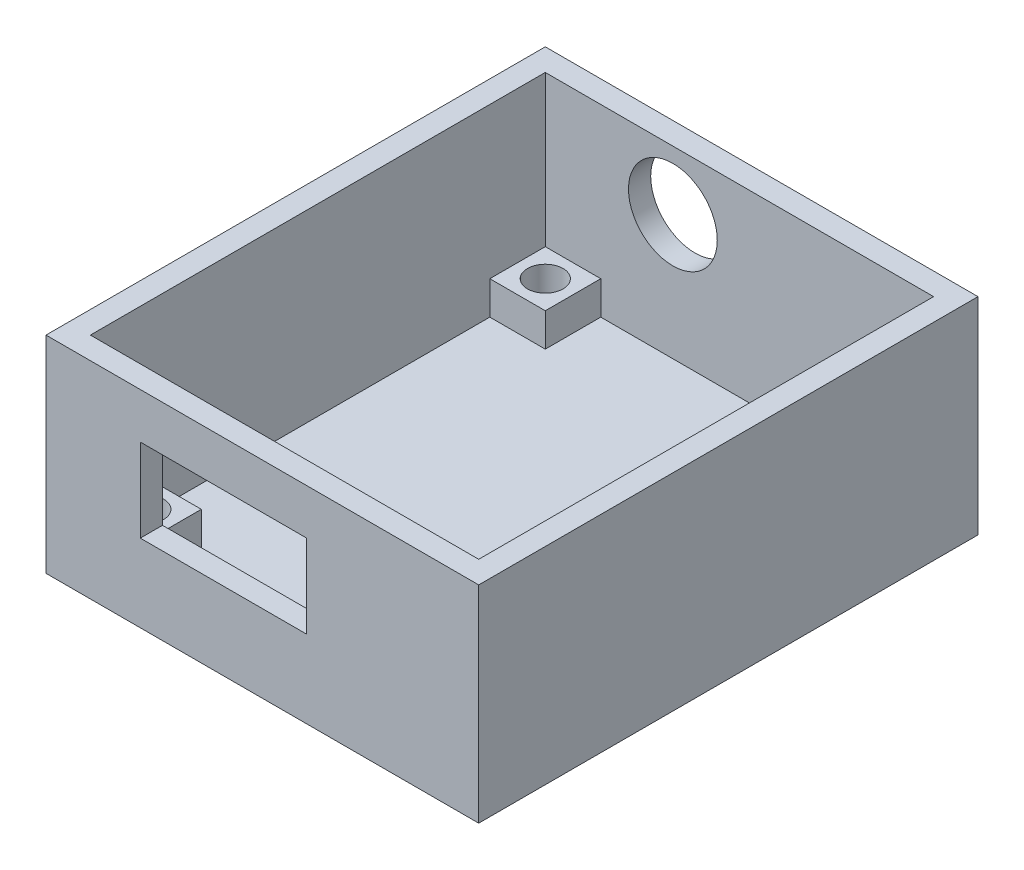
from build123d import *

# Parameters (mm, degrees)
SKETCH1_W             = 39
SKETCH1_H             = 45
BODY_DEPTH            = 18.6
SHELL1_T              = -2
SKETCH3_W             = 5
SKETCH3_H             = 5
INSERTS_SUPPORT_DEPTH = 3
SKETCH4_R             = 1.6
INSERTS_HOLES_DEPTH   = 4
USB_HOLE_REACH        = 54.452
SKETCH5_W             = 15
SKETCH5_H             = 7.5
JACK_HOLE_REACH       = 54.452
SKETCH6_R             = 4


with BuildPart() as part:
    # Sketch1 → Body (new body)
    with BuildSketch(Plane(origin=(0, 0, 0), x_dir=(1, 0, 0), z_dir=(0, 1, 0))):
        Rectangle(SKETCH1_W, SKETCH1_H)
    extrude(amount=BODY_DEPTH)

    # Shell1
    shell1_openings = [part.faces().sort_by_distance(p)[0] for p in [
        (0, 18.6, 0),
    ]]
    offset(amount=SHELL1_T, openings=shell1_openings, kind=Kind.INTERSECTION)

    # Sketch3 → Inserts_Support (add)
    with BuildSketch(Plane(origin=(0, 2, 0), x_dir=(1, 0, 0), z_dir=(0, 1, 0))):
        with Locations((-15, 18)):
            Rectangle(SKETCH3_W, SKETCH3_H)
        with Locations((15, 18)):
            Rectangle(SKETCH3_W, SKETCH3_H)
        with Locations((15, -18)):
            Rectangle(SKETCH3_W, SKETCH3_H)
        with Locations((-15, -18)):
            Rectangle(SKETCH3_W, SKETCH3_H)
    extrude(amount=INSERTS_SUPPORT_DEPTH)

    # Sketch4 → Inserts_Holes (cut)
    with BuildSketch(Plane(origin=(0, 5, 0), x_dir=(1, 0, 0), z_dir=(0, 1, 0))):
        with Locations((-15, 18)):
            Circle(SKETCH4_R)
        with Locations((15, 18)):
            Circle(SKETCH4_R)
        with Locations((15, -18)):
            Circle(SKETCH4_R)
        with Locations((-15, -18)):
            Circle(SKETCH4_R)
    extrude(amount=-INSERTS_HOLES_DEPTH, mode=Mode.SUBTRACT)

    # Sketch5 → USB_Hole (cut, up to next)
    with BuildSketch(Plane.XY.offset(22.5), mode=Mode.PRIVATE) as usb_hole_sk1:
        with Locations((-3.5, 10.75)):
            Rectangle(SKETCH5_W, SKETCH5_H)
    usb_hole_tool1 = extrude(usb_hole_sk1.sketch, amount=-USB_HOLE_REACH, mode=Mode.PRIVATE) & part.part
    add(usb_hole_tool1.solids().sort_by_distance((-3.5, 10.75, 22.5))[0], mode=Mode.SUBTRACT)

    # Sketch6 → Jack_Hole (cut, up to next)
    with BuildSketch(Plane(origin=(0, 0, -22.5), x_dir=(-1, 0, 0), z_dir=(0, 0, -1)), mode=Mode.PRIVATE) as jack_hole_sk1:
        with Locations((6, 13.25)):
            Circle(SKETCH6_R)
    jack_hole_tool1 = extrude(jack_hole_sk1.sketch, amount=-JACK_HOLE_REACH, mode=Mode.PRIVATE) & part.part
    add(jack_hole_tool1.solids().sort_by_distance((-6, 13.25, -22.5))[0], mode=Mode.SUBTRACT)


solid = part.part
